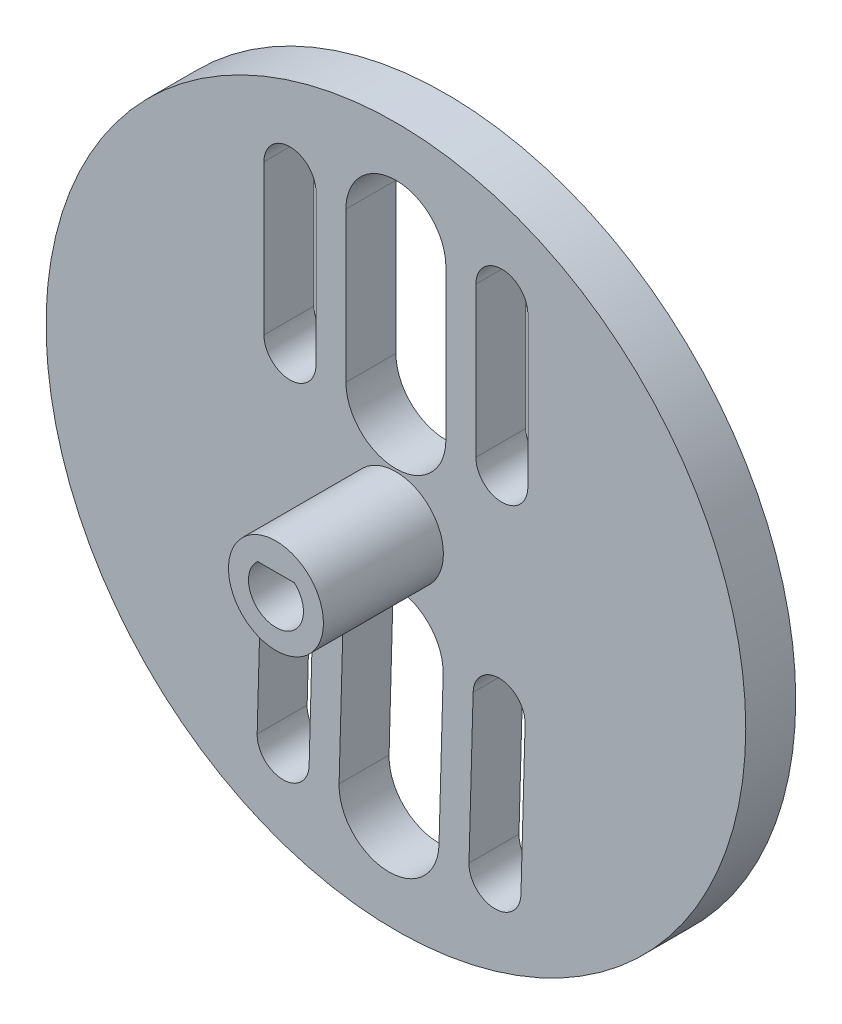
from build123d import *

# Parameters (mm, degrees)
ESQUISSE1_R             = 35
BOSS_EXTRU_1_DEPTH      = 5
ENL_V_MAT_EXTRU_1_REACH = 51.749
BOSS_EXTRU_3_START      = 12
ESQUISSE3_R             = 4.75
BOSS_EXTRU_3_DEPTH      = 12


with BuildPart() as part:
    # Esquisse1 → Boss.-Extru.1 (new body)
    with BuildSketch(Plane.XY):
        Circle(ESQUISSE1_R)
        with BuildLine():
            ThreePointArc((4.728110875, -10.282810642), (4.727635283, -10.351772147), (4.726208599, -10.420720532))
            Line((4.726208599, -10.420720532), (4.312478928, -25.415013705))
            ThreePointArc((4.312478928, -25.415013705), (-0.823528687, -30.275201539), (-5.683716521, -25.139193925))
            Line((-5.683716521, -25.139193925), (-5.26998685, -10.144900751))
            ThreePointArc((-5.26998685, -10.144900751), (-0.202927621, -5.283286233), (4.728110875, -10.282810642))
        make_face(mode=Mode.SUBTRACT)
        with BuildLine():
            Line((-8.268845484, -10.062154817), (-8.682575156, -25.05644799))
            ThreePointArc((-8.682575156, -25.05644799), (-11.353299115, -27.583745664), (-13.880596789, -24.913021704))
            Line((-13.880596789, -24.913021704), (-13.466867118, -9.918728531))
            ThreePointArc((-13.466867118, -9.918728531), (-10.796143158, -7.391430858), (-8.268845484, -10.062154817))
        make_face(mode=Mode.SUBTRACT)
        with BuildLine():
            Line((12.923088867, -10.646892753), (12.509359196, -25.641185926))
            ThreePointArc((12.509359196, -25.641185926), (9.838635236, -28.168483599), (7.311337562, -25.49775964))
            Line((7.311337562, -25.49775964), (7.725067233, -10.503466467))
            ThreePointArc((7.725067233, -10.503466467), (10.395791193, -7.976168793), (12.923088867, -10.646892753))
        make_face(mode=Mode.SUBTRACT)
        with BuildLine():
            Line((-13.2, 10), (-13.2, 25))
            ThreePointArc((-13.2, 25), (-10.6, 27.6), (-8, 25))
            Line((-8, 25), (-8, 10))
            ThreePointArc((-8, 10), (-10.6, 7.4), (-13.2, 10))
        make_face(mode=Mode.SUBTRACT)
        with BuildLine():
            ThreePointArc((5, 10), (0, 5), (-5, 10))
            Line((-5, 10), (-5, 25))
            ThreePointArc((-5, 25), (0, 30), (5, 25))
            Line((5, 25), (5, 10))
        make_face(mode=Mode.SUBTRACT)
        with BuildLine():
            ThreePointArc((8, 25), (10.6, 27.6), (13.2, 25))
            Line((13.2, 25), (13.2, 10))
            ThreePointArc((13.2, 10), (10.6, 7.4), (8, 10))
            Line((8, 10), (8, 25))
        make_face(mode=Mode.SUBTRACT)
    extrude(amount=BOSS_EXTRU_1_DEPTH)

    # Esquisse2 → Enlèv. mat.-Extru.1 (cut, up to next)
    with BuildSketch(Plane.XY.offset(5), mode=Mode.PRIVATE) as enl_v_mat_extru_1_sk1:
        with BuildLine():
            Line((1.833030278, 2.05), (-1.833030278, 2.05))
            ThreePointArc((-1.833030278, 2.05), (-1.122868366, -2.510312059), (2.75, 0))
            ThreePointArc((2.75, 0), (2.510312059, 1.122868366), (1.833030278, 2.05))
        make_face()
    enl_v_mat_extru_1_tool1 = extrude(enl_v_mat_extru_1_sk1.sketch, amount=-ENL_V_MAT_EXTRU_1_REACH, mode=Mode.PRIVATE) & part.part
    add(enl_v_mat_extru_1_tool1.solids().sort_by_distance((0, -0.186648, 5))[0], mode=Mode.SUBTRACT)

    # Esquisse3 → Boss.-Extru.3 (add)
    with BuildSketch(Plane.XY.offset(5).offset(BOSS_EXTRU_3_START)):
        Circle(ESQUISSE3_R)
        with BuildLine():
            ThreePointArc((1.833030278, 2.05), (0, -2.75), (-1.833030278, 2.05))
            Line((-1.833030278, 2.05), (1.833030278, 2.05))
        make_face(mode=Mode.SUBTRACT)
    extrude(amount=-BOSS_EXTRU_3_DEPTH)


solid = part.part
